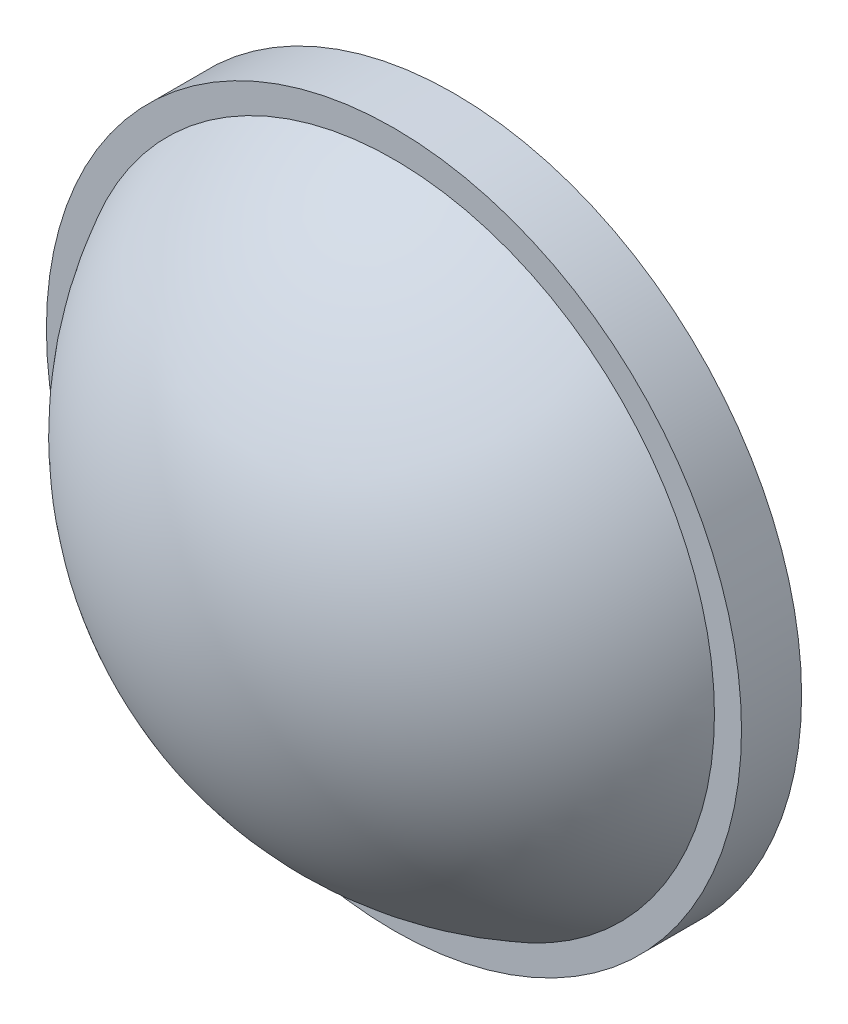
from build123d import *

# Parameters (mm, degrees)
SKETCH_1_R      = 17.35
EXTRUDE_1_DEPTH = 3


# Read off the part's stored shape, not the designer's step: 圓頂1
with BuildPart() as part:
    # 草圖1 → 填料-伸長1 (new body)
    with BuildSketch(Plane.XY):
        Circle(SKETCH_1_R)
    extrude(amount=EXTRUDE_1_DEPTH)

    # 圓頂1 outline → 圓頂1 (revolve)
    with BuildSketch(Plane.XZ):
        with BuildLine():
            Line((0, 3), (16.000000008, 2.999999984))
            ThreePointArc((16.000000008, 2.999999984), (9.381364514, 10.155288985), (0, 12.8))
            Line((0, 12.8), (0, 3))
        make_face()
    revolve(axis=Axis((0, 0, 0), (0, 0, 1)))


solid = part.part
